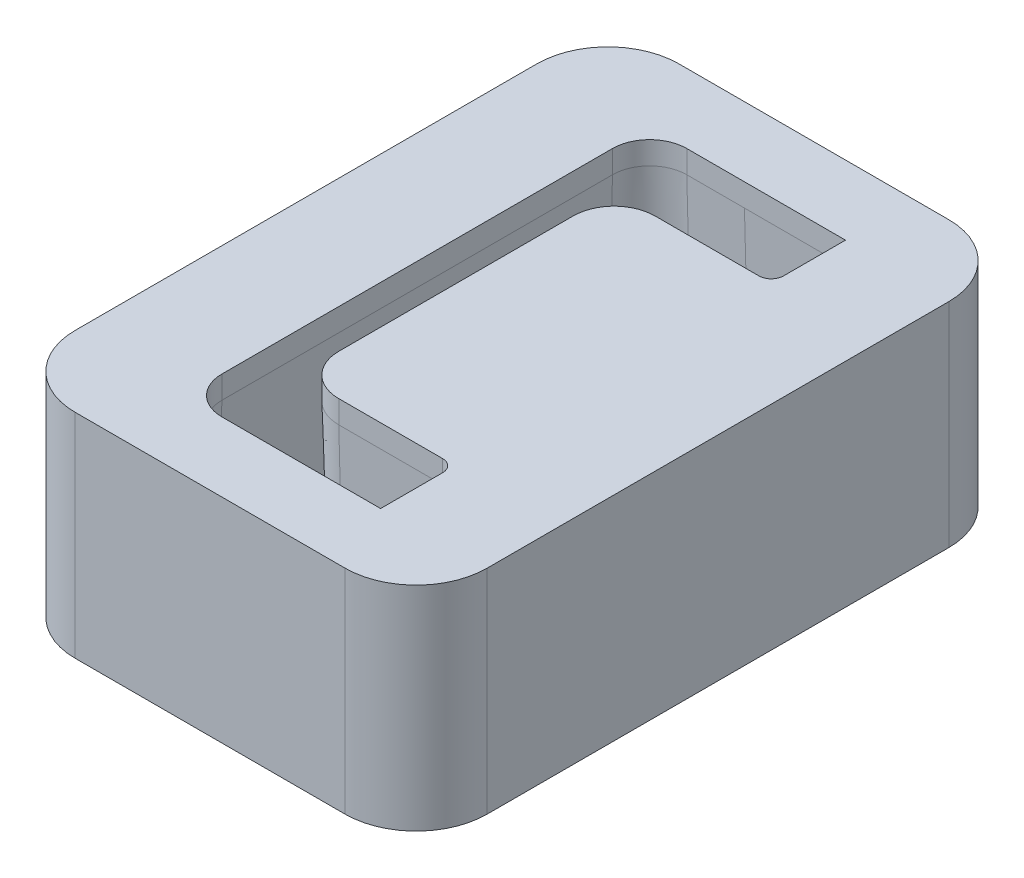
from build123d import *

# Parameters (mm, degrees)
SKETCH1_W                   = 58
SKETCH1_H                   = 85
BOSS_EXTRUDE1_DEPTH         = 30
FILLET1_R                   = 10
CUT_EXTRUDE1_REACH          = 61.559
M6_TAPPED_HOLE1_D           = 5
M6_TAPPED_HOLE1_DEPTH       = 17
M6_TAPPED_HOLE1_CSINK_D     = 6.05
M6_TAPPED_HOLE1_CSINK_ANGLE = 90
M6_TAPPED_HOLE1_TIP         = 1.502151548


with BuildPart() as part:
    # Sketch1 → Boss-Extrude1 (new body)
    with BuildSketch(Plane(origin=(0, 0, 0), x_dir=(1, 0, 0), z_dir=(0, 1, 0))):
        Rectangle(SKETCH1_W, SKETCH1_H)
    extrude(amount=-BOSS_EXTRUDE1_DEPTH)

    # Fillet1
    fillet1_edges = [part.edges().sort_by_distance(p)[0] for p in [
        (-29, -15, -42.5),
        (29, -15, -42.5),
        (29, -15, 42.5),
        (-29, -15, 42.5),
    ]]
    fillet(fillet1_edges, radius=FILLET1_R)

    # Sketch2 → Cut-Extrude1 (cut, up to next)
    with BuildSketch(Plane(origin=(0, 0, 0), x_dir=(1, 0, 0), z_dir=(0, 1, 0)), mode=Mode.PRIVATE) as cut_extrude1_sk1:
        with BuildLine():
            Line((14.23, 32.73), (-8.12, 32.73))
            ThreePointArc((-8.12, 32.73), (-11.818168466, 31.198168466), (-13.35, 27.5))
            Line((-13.35, 27.5), (-13.35, -27.5))
            ThreePointArc((-13.35, -27.5), (-11.818168466, -31.198168466), (-8.12, -32.73))
            Line((-8.12, -32.73), (14.23, -32.73))
            Line((14.23, -32.73), (14.23, -24))
            ThreePointArc((14.23, -24), (13.723294731, -22.776705269), (12.5, -22.27))
            Line((12.5, -22.27), (-2.12, -22.27))
            ThreePointArc((-2.12, -22.27), (-6.200006127, -20.580006127), (-7.89, -16.5))
            Line((-7.89, -16.5), (-7.89, 16.5))
            ThreePointArc((-7.89, 16.5), (-6.200006127, 20.580006127), (-2.12, 22.27))
            Line((-2.12, 22.27), (12.5, 22.27))
            ThreePointArc((12.5, 22.27), (13.723294731, 22.776705269), (14.23, 24))
            Line((14.23, 24), (14.23, 32.73))
        make_face()
    cut_extrude1_tool1 = extrude(cut_extrude1_sk1.sketch, amount=-CUT_EXTRUDE1_REACH, mode=Mode.PRIVATE) & part.part
    add(cut_extrude1_tool1.solids().sort_by_distance((3.055, 0, -32.019671))[0], mode=Mode.SUBTRACT)

    # Cut-Sweep1: sweep along a path in Sketch5
    with BuildLine(Plane(origin=(0, 0, 0), x_dir=(1, 0, 0), z_dir=(0, 1, 0))) as cut_sweep1_path:
        Line((12.5, -22.27), (-2.12, -22.27))
        ThreePointArc((-2.12, -22.27), (-6.200006127, -20.580006127), (-7.89, -16.5))
        Line((-7.89, -16.5), (-7.89, 16.5))
        ThreePointArc((-7.89, 16.5), (-6.200006127, 20.580006127), (-2.12, 22.27))
        Line((-2.12, 22.27), (12.5, 22.27))
        ThreePointArc((12.5, 22.27), (13.723294731, 22.776705269), (14.23, 24))
        Line((14.23, 24), (14.23, 32.73))
        Line((14.23, 32.73), (-8.12, 32.73))
        ThreePointArc((-8.12, 32.73), (-11.818168466, 31.198168466), (-13.35, 27.5))
        Line((-13.35, 27.5), (-13.35, -27.5))
        ThreePointArc((-13.35, -27.5), (-11.818168466, -31.198168466), (-8.12, -32.73))
        Line((-8.12, -32.73), (14.23, -32.73))
        Line((14.23, -32.73), (14.23, -24))
        ThreePointArc((14.23, -24), (13.723294731, -22.776705269), (12.5, -22.27))
    # Sketch3 → Cut-Sweep1 (sweep, cut)
    with BuildSketch(Plane(origin=(0, 0, 0), x_dir=(0, 0, -1), z_dir=(1, 0, 0))):
        Polygon((32.73, -3.2), (33.431782698, -30), (32.73, -30), align=None)
    sweep(path=cut_sweep1_path.line, transition=Transition.RIGHT, mode=Mode.SUBTRACT)

    # M6 Tapped Hole1
    with Locations(Plane(origin=(0, -30, 0), x_dir=(-1, 0, 0), z_dir=(0, -1, 0))):
        with Locations((-22, 35.5), (22, 35.5), (22, -35.5), (-22, -35.5)):
            CounterSinkHole(M6_TAPPED_HOLE1_D / 2, M6_TAPPED_HOLE1_CSINK_D / 2, depth=M6_TAPPED_HOLE1_DEPTH, counter_sink_angle=M6_TAPPED_HOLE1_CSINK_ANGLE)
            with Locations((0, 0, -(M6_TAPPED_HOLE1_DEPTH + M6_TAPPED_HOLE1_TIP / 2))):  # 118° drill point
                Cone(0, M6_TAPPED_HOLE1_D / 2, M6_TAPPED_HOLE1_TIP, mode=Mode.SUBTRACT)


solid = part.part
